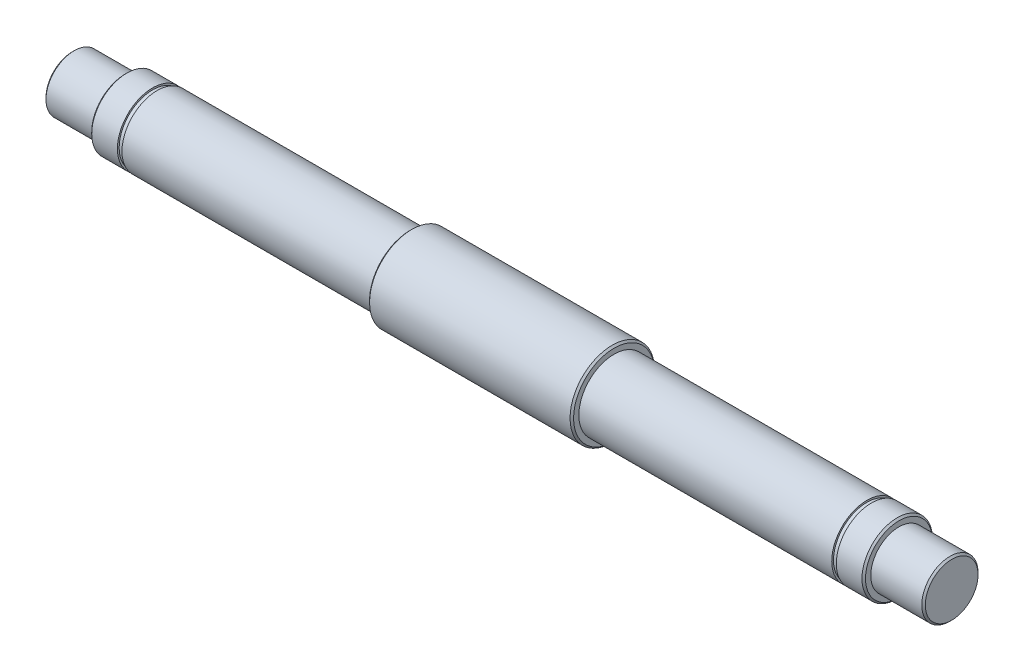
from build123d import *

# Parameters (mm, degrees)
CHAMFER1_SIZE = 0.5


with BuildPart() as part:
    # Sketch1 → Revolve1 (revolve)
    with BuildSketch(Plane(origin=(0, 0, 0), x_dir=(1, 0, 0), z_dir=(0, 1, 0))):
        Polygon((-125, 0), (-125, 8), (-110, 8), (-110, 10), (-102.2, 10), (-102.2, 9.5), (-100.9, 9.5), (-100.9, 10), (-29, 10), (-29, 12), (29, 12), (29, 10), (100.9, 10), (100.9, 9.5), (102.2, 9.5), (102.2, 10), (110, 10), (110, 8), (125, 8), (125, 0), align=None)
    revolve(axis=Axis((-125, 0, 0), (1, 0, 0)))

    # Chamfer1
    chamfer1_edges = [part.edges().sort_by_distance(p)[0] for p in [
        (110, 0, 10),
        (125, 0, 8),
        (29, 0, 12),
        (-29, 0, 12),
        (-110, 0, 10),
        (-125, 0, 8),
    ]]
    chamfer(chamfer1_edges, length=CHAMFER1_SIZE)


solid = part.part
